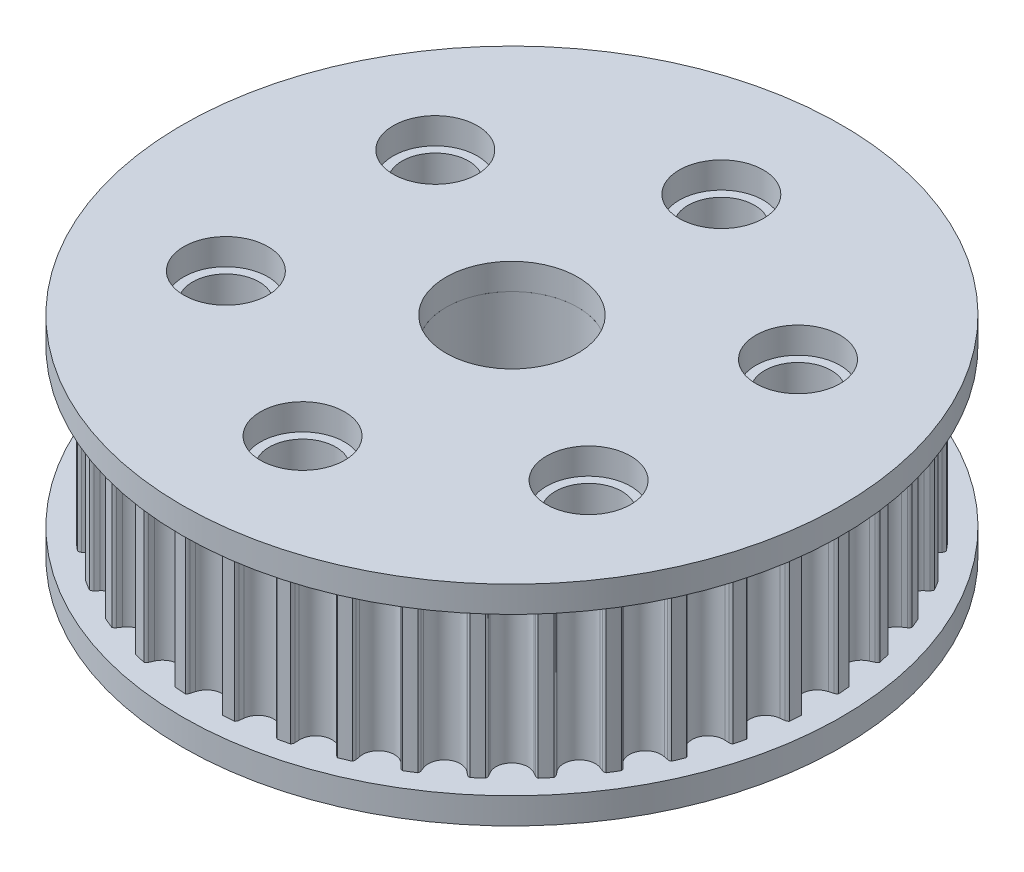
from build123d import *

# Parameters (mm, degrees)
SKETCH1_R                 = 18.717593782
TOOTHOD_DEPTH             = 4.7625
TOOTHPROFILE_DEPTH        = 27.895688135
TOOTHPATTERN_COUNT        = 40
BORE_DEPTH                = 27.848352629
BORE_DEPTH_BACK           = 27.848352629
SKETCH8_R                 = 19.987593782
SKETCH8_R_2               = 4
BOSS_EXTRUDE1_DEPTH       = 1.5875
SKETCH9_R                 = 2.0193
CUT_EXTRUDE1_DEPTH        = 31.988672292
SKETCH10_R                = 2.5527
CUT_EXTRUDE2_DEPTH        = 31.988672292
CIRPATTERN1_START         = -6.35
CIRPATTERN1_OUTLINE_R     = 2.0193
CIRPATTERN1_DEPTH         = 12.7
CIRPATTERN1_2_OUTLINE_R   = 2.5527
CIRPATTERN1_2_OUTLINE_R_2 = 2.0193
CIRPATTERN1_2_DEPTH       = 1.5875
CIRPATTERN1_START_2       = 4.7625
CIRPATTERN1_3_OUTLINE_R   = 2.5527
CIRPATTERN1_3_OUTLINE_R_2 = 2.0193
CIRPATTERN1_3_DEPTH       = 1.5875


# Read off the part's stored shape, not the designer's step: CirPattern1
with BuildPart() as part:
    # Sketch1 → ToothOD (new, symmetric)
    with BuildSketch(Plane(origin=(0, 0, 0), x_dir=(1, 0, 0), z_dir=(0, 1, 0))):
        with Locations(Location((0, 0, 0), (0, 0, 90))):
            Circle(SKETCH1_R)
    extrude(amount=TOOTHOD_DEPTH, both=True)

    # Sketch2 → ToothProfile (cut, symmetric)
    with BuildSketch(Plane(origin=(0, 0, 0), x_dir=(1, 0, 0), z_dir=(0, 1, 0))):
        with BuildLine():
            ThreePointArc((-0.937033068, 18.267655778), (-0.590385173, 17.749481168), (0, 17.549193782))
            ThreePointArc((0, 17.549193782), (0.590385173, 17.749481168), (0.937033068, 18.267655778))
            ThreePointArc((0.937033068, 18.267655778), (0.971699064, 18.39376724), (1.007805813, 18.519473782))
            ThreePointArc((1.007805813, 18.519473782), (1.053477193, 18.612017257), (1.127830075, 18.68358414))
            ThreePointArc((1.127830075, 18.68358414), (0, 18.717593782), (-1.127830075, 18.68358414))
            ThreePointArc((-1.127830075, 18.68358414), (-1.053477193, 18.612017257), (-1.007805813, 18.519473782))
            ThreePointArc((-1.007805813, 18.519473782), (-0.971699064, 18.39376724), (-0.937033068, 18.267655778))
        make_face()
    toothprofile = extrude(amount=TOOTHPROFILE_DEPTH, both=True, mode=Mode.SUBTRACT)

    # ToothPattern: ToothProfile ×40 about axis
    toothpattern_axis = Axis((0, 0, 0), (0, 1, 0))
    for i in range(1, TOOTHPATTERN_COUNT):
        add(toothprofile.rotate(toothpattern_axis, i * 360 / TOOTHPATTERN_COUNT), mode=Mode.SUBTRACT)

    # Sketch7 → Bore (cut, two sides: drawn at the far end of the back side and taken through both)
    with BuildSketch(Plane.XZ.offset(-BORE_DEPTH_BACK)):
        with BuildLine():
            ThreePointArc((2.162585258, -3.365), (0, 4), (-2.162585258, -3.365))
            ThreePointArc((-2.162585258, -3.365), (0, -4), (2.162585258, -3.365))
        make_face()
    extrude(amount=BORE_DEPTH + BORE_DEPTH_BACK, mode=Mode.SUBTRACT)


with BuildPart() as body_2:
    # Sketch8 → Boss-Extrude1 (new body)
    with BuildSketch(Plane(origin=(0, -4.7625, 0), x_dir=(1, 0, 0), z_dir=(0, 1, 0))):
        with Locations(Location((0, 0, 0), (0, 0, 270))):
            Circle(SKETCH8_R)
        with Locations(Location((0, 0, 0), (0, 0, 270))):
            Circle(SKETCH8_R_2, mode=Mode.SUBTRACT)
    extrude(amount=-BOSS_EXTRUDE1_DEPTH)


with BuildPart() as body_3:
    # Mirror1: mirrored copy
    add(body_2.part.mirror(Plane.ZX))


with BuildPart() as cut_extrude1_tool:
    # Sketch9 → Cut-Extrude1 (new, through all)
    with BuildSketch(Plane.XZ.offset(6.35)):
        with Locations(Location((0, 12.7, 0), (0, 0, 270))):
            Circle(SKETCH9_R)
    extrude(amount=-CUT_EXTRUDE1_DEPTH)


with BuildPart() as part_1:
    add(part.part)

    # Cut-Extrude1: cut by cut_extrude1_tool
    add(cut_extrude1_tool.part, mode=Mode.SUBTRACT)


with BuildPart() as body_2_1:
    add(body_2.part)

    # Cut-Extrude1: cut by cut_extrude1_tool
    add(cut_extrude1_tool.part, mode=Mode.SUBTRACT)


with BuildPart() as body_3_1:
    add(body_3.part)

    # Cut-Extrude1: cut by cut_extrude1_tool
    add(cut_extrude1_tool.part, mode=Mode.SUBTRACT)


with BuildPart() as cut_extrude2_tool:
    # Sketch10 → Cut-Extrude2 (new, through all)
    with BuildSketch(Plane.XZ.offset(6.35)):
        with Locations(Location((0, 12.7, 0), (0, 0, 270))):
            Circle(SKETCH10_R)
    extrude(amount=-CUT_EXTRUDE2_DEPTH)


with BuildPart() as body_2_2:
    add(body_2_1.part)

    # Cut-Extrude2: cut by cut_extrude2_tool
    add(cut_extrude2_tool.part, mode=Mode.SUBTRACT)


with BuildPart() as body_3_2:
    add(body_3_1.part)

    # Cut-Extrude2: cut by cut_extrude2_tool
    add(cut_extrude2_tool.part, mode=Mode.SUBTRACT)


with BuildPart() as cirpattern1_tool:
    # CirPattern1 outline → CirPattern1 (new body)
    with BuildSketch(Plane(origin=(0, 0, 0), x_dir=(1, 0, 0), z_dir=(0, 1, 0)).offset(CIRPATTERN1_START)):
        with Locations((-10.998522628, -6.35)):
            Circle(CIRPATTERN1_OUTLINE_R)
        with Locations((-10.998522628, 6.35)):
            Circle(CIRPATTERN1_OUTLINE_R)
        with Locations((0, 12.7)):
            Circle(CIRPATTERN1_OUTLINE_R)
        with Locations((10.998522628, 6.35)):
            Circle(CIRPATTERN1_OUTLINE_R)
        with Locations((10.998522628, -6.35)):
            Circle(CIRPATTERN1_OUTLINE_R)
    extrude(amount=CIRPATTERN1_DEPTH)


with BuildPart() as part_2:
    add(part_1.part)

    # CirPattern1: cut by cirpattern1_tool
    add(cirpattern1_tool.part, mode=Mode.SUBTRACT)


with BuildPart() as body_2_3:
    add(body_2_2.part)

    # CirPattern1: cut by cirpattern1_tool
    add(cirpattern1_tool.part, mode=Mode.SUBTRACT)

    # CirPattern1 2 outline → CirPattern1 2 (cut)
    # profile 1 of 5: a face of its own
    with BuildSketch(Plane(origin=(0, 0, 0), x_dir=(1, 0, 0), z_dir=(0, 1, 0)).offset(CIRPATTERN1_START)):
        with Locations((-10.998522628, -6.35)):
            Circle(CIRPATTERN1_2_OUTLINE_R)
        with Locations((-10.998522628, -6.35)):
            Circle(CIRPATTERN1_2_OUTLINE_R_2, mode=Mode.SUBTRACT)
    # profile 2 of 5: a face of its own
    with BuildSketch(Plane(origin=(0, 0, 0), x_dir=(1, 0, 0), z_dir=(0, 1, 0)).offset(CIRPATTERN1_START)):
        with Locations((-10.998522628, 6.35)):
            Circle(CIRPATTERN1_2_OUTLINE_R)
        with Locations((-10.998522628, 6.35)):
            Circle(CIRPATTERN1_2_OUTLINE_R_2, mode=Mode.SUBTRACT)
    # profile 3 of 5: a face of its own
    with BuildSketch(Plane(origin=(0, 0, 0), x_dir=(1, 0, 0), z_dir=(0, 1, 0)).offset(CIRPATTERN1_START)):
        with Locations((0, 12.7)):
            Circle(CIRPATTERN1_2_OUTLINE_R)
        with Locations((0, 12.7)):
            Circle(CIRPATTERN1_2_OUTLINE_R_2, mode=Mode.SUBTRACT)
    # profile 4 of 5: a face of its own
    with BuildSketch(Plane(origin=(0, 0, 0), x_dir=(1, 0, 0), z_dir=(0, 1, 0)).offset(CIRPATTERN1_START)):
        with Locations((10.998522628, 6.35)):
            Circle(CIRPATTERN1_2_OUTLINE_R)
        with Locations((10.998522628, 6.35)):
            Circle(CIRPATTERN1_2_OUTLINE_R_2, mode=Mode.SUBTRACT)
    # profile 5 of 5: a face of its own
    with BuildSketch(Plane(origin=(0, 0, 0), x_dir=(1, 0, 0), z_dir=(0, 1, 0)).offset(CIRPATTERN1_START)):
        with Locations((10.998522628, -6.35)):
            Circle(CIRPATTERN1_2_OUTLINE_R)
        with Locations((10.998522628, -6.35)):
            Circle(CIRPATTERN1_2_OUTLINE_R_2, mode=Mode.SUBTRACT)
    extrude(amount=CIRPATTERN1_2_DEPTH, mode=Mode.SUBTRACT)


with BuildPart() as body_3_3:
    add(body_3_2.part)

    # CirPattern1: cut by cirpattern1_tool
    add(cirpattern1_tool.part, mode=Mode.SUBTRACT)

    # CirPattern1 3 outline → CirPattern1 3 (cut)
    # profile 1 of 5: a face of its own
    with BuildSketch(Plane(origin=(0, 0, 0), x_dir=(1, 0, 0), z_dir=(0, 1, 0)).offset(CIRPATTERN1_START_2)):
        with Locations((-10.998522628, -6.35)):
            Circle(CIRPATTERN1_3_OUTLINE_R)
        with Locations((-10.998522628, -6.35)):
            Circle(CIRPATTERN1_3_OUTLINE_R_2, mode=Mode.SUBTRACT)
    # profile 2 of 5: a face of its own
    with BuildSketch(Plane(origin=(0, 0, 0), x_dir=(1, 0, 0), z_dir=(0, 1, 0)).offset(CIRPATTERN1_START_2)):
        with Locations((-10.998522628, 6.35)):
            Circle(CIRPATTERN1_3_OUTLINE_R)
        with Locations((-10.998522628, 6.35)):
            Circle(CIRPATTERN1_3_OUTLINE_R_2, mode=Mode.SUBTRACT)
    # profile 3 of 5: a face of its own
    with BuildSketch(Plane(origin=(0, 0, 0), x_dir=(1, 0, 0), z_dir=(0, 1, 0)).offset(CIRPATTERN1_START_2)):
        with Locations((0, 12.7)):
            Circle(CIRPATTERN1_3_OUTLINE_R)
        with Locations((0, 12.7)):
            Circle(CIRPATTERN1_3_OUTLINE_R_2, mode=Mode.SUBTRACT)
    # profile 4 of 5: a face of its own
    with BuildSketch(Plane(origin=(0, 0, 0), x_dir=(1, 0, 0), z_dir=(0, 1, 0)).offset(CIRPATTERN1_START_2)):
        with Locations((10.998522628, 6.35)):
            Circle(CIRPATTERN1_3_OUTLINE_R)
        with Locations((10.998522628, 6.35)):
            Circle(CIRPATTERN1_3_OUTLINE_R_2, mode=Mode.SUBTRACT)
    # profile 5 of 5: a face of its own
    with BuildSketch(Plane(origin=(0, 0, 0), x_dir=(1, 0, 0), z_dir=(0, 1, 0)).offset(CIRPATTERN1_START_2)):
        with Locations((10.998522628, -6.35)):
            Circle(CIRPATTERN1_3_OUTLINE_R)
        with Locations((10.998522628, -6.35)):
            Circle(CIRPATTERN1_3_OUTLINE_R_2, mode=Mode.SUBTRACT)
    extrude(amount=CIRPATTERN1_3_DEPTH, mode=Mode.SUBTRACT)


solid = Compound([part_2.part, body_2_3.part, body_3_3.part])
